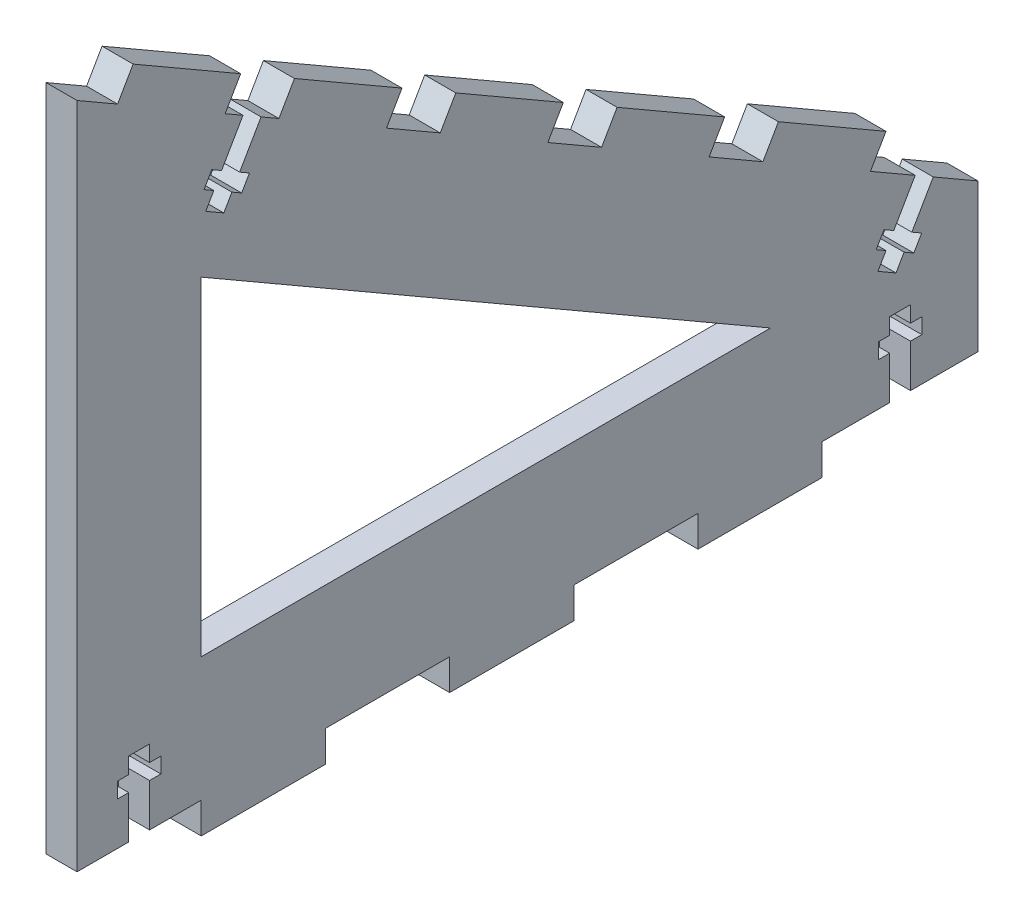
from build123d import *

# Parameters (mm, degrees)
BOSS_EXTRUDE1_DEPTH = 3.175
CUT_EXTRUDE1_DEPTH  = 6.35
SKETCH3_W           = 6.35
SKETCH3_H           = 25.4
BOSS_EXTRUDE2_DEPTH = 6.35
LPATTERN1_COUNT     = 5
LPATTERN1_PITCH     = 38.1
SKETCH4_W           = 6.35
SKETCH4_H           = 25.4
BOSS_EXTRUDE3_DEPTH = 6.35
LPATTERN2_COUNT     = 3
LPATTERN2_PITCH     = 50.8
CUT_EXTRUDE2_DEPTH  = 6.35
CUT_EXTRUDE3_DEPTH  = 6.35


with BuildPart() as part:
    # Sketch1 → Boss-Extrude1 (new, symmetric)
    with BuildSketch(Plane.ZY.offset(32.038437852)):
        Polygon((-213.509598145, 95.25), (-213.509598145, 125.492599154), (-29.238522478, 231.881554295), (-29.238522478, 95.25), align=None)
    extrude(amount=BOSS_EXTRUDE1_DEPTH, both=True)

    # Sketch2 → Cut-Extrude1 (cut)
    with BuildSketch(Plane.ZY.offset(35.213437852)):
        Polygon((-54.638522478, 120.65), (-54.638522478, 187.887463782), (-171.097225921, 120.65), align=None)
    extrude(amount=-CUT_EXTRUDE1_DEPTH, mode=Mode.SUBTRACT)

    # Sketch3 → Boss-Extrude2 (add)
    with BuildSketch(Plane(origin=(0, 186.571817339, -107.717288964), x_dir=(1, 0, 0), z_dir=(0, 0.8660254037844386, -0.5000000000000001))):
        with Locations((-32.038437852, 84.058436368)):
            Rectangle(SKETCH3_W, SKETCH3_H)
    boss_extrude2 = extrude(amount=BOSS_EXTRUDE2_DEPTH)

    # LPattern1: Boss-Extrude2 ×5
    with Locations(*[Vector(0, 0.5000000000000001, 0.8660254037844386) * (i * LPATTERN1_PITCH) for i in range(1, LPATTERN1_COUNT)]):
        add(boss_extrude2)

    # Sketch4 → Boss-Extrude3 (add)
    with BuildSketch(Plane.XZ.offset(-95.25)):
        with Locations((-32.038437852, -67.338522478)):
            Rectangle(SKETCH4_W, SKETCH4_H)
    boss_extrude3 = extrude(amount=BOSS_EXTRUDE3_DEPTH)

    # LPattern2: Boss-Extrude3 ×3
    with Locations(*[(0, 0, -i * LPATTERN2_PITCH) for i in range(1, LPATTERN2_COUNT)]):
        add(boss_extrude3)

    # Sketch5 → Cut-Extrude2 (cut)
    with BuildSketch(Plane(origin=(-28.863437852, 0, 0), x_dir=(0, 0, -1), z_dir=(1, 0, 0))):
        Polygon((195.440460312, 95.25), (199.707660312, 95.25), (199.707660312, 104.013), (202.019060312, 104.013), (202.019060312, 107.188), (199.707660312, 107.188), (199.707660312, 110.49), (195.440460312, 110.49), (195.440460312, 107.188), (193.129060312, 107.188), (193.129060312, 104.013), (195.440460312, 104.013), align=None)
        Polygon((39.804922478, 95.25), (44.072122478, 95.25), (44.072122478, 104.013), (46.383522478, 104.013), (46.383522478, 107.188), (44.072122478, 107.188), (44.072122478, 110.49), (39.804922478, 110.49), (39.804922478, 107.188), (37.493522478, 107.188), (37.493522478, 104.013), (39.804922478, 104.013), align=None)
    extrude(amount=-CUT_EXTRUDE2_DEPTH, mode=Mode.SUBTRACT)

    # Sketch6 → Cut-Extrude3 (cut)
    with BuildSketch(Plane(origin=(-28.863437852, 0, 0), x_dir=(0, 0, -1), z_dir=(1, 0, 0))):
        Polygon((204.358827318, 130.775799154), (200.663323715, 132.909399154), (196.281823715, 125.320418541), (194.280092597, 126.476118541), (192.692592597, 123.726487884), (194.694323715, 122.570787884), (193.043323715, 119.711172001), (196.738827318, 117.577572001), (198.389827318, 120.437187884), (200.391558437, 119.281487884), (201.979058437, 122.031118541), (199.977327318, 123.186818541), align=None)
        Polygon((66.877294468, 210.150799154), (63.181790865, 212.284399154), (58.800290865, 204.695418541), (56.798559746, 205.851118541), (55.211059746, 203.101487884), (57.212790865, 201.945787884), (55.561790865, 199.086172001), (59.257294468, 196.952572001), (60.908294468, 199.812187884), (62.910025586, 198.656487884), (64.497525586, 201.406118541), (62.495794468, 202.561818541), align=None)
    extrude(amount=-CUT_EXTRUDE3_DEPTH, mode=Mode.SUBTRACT)


solid = part.part
